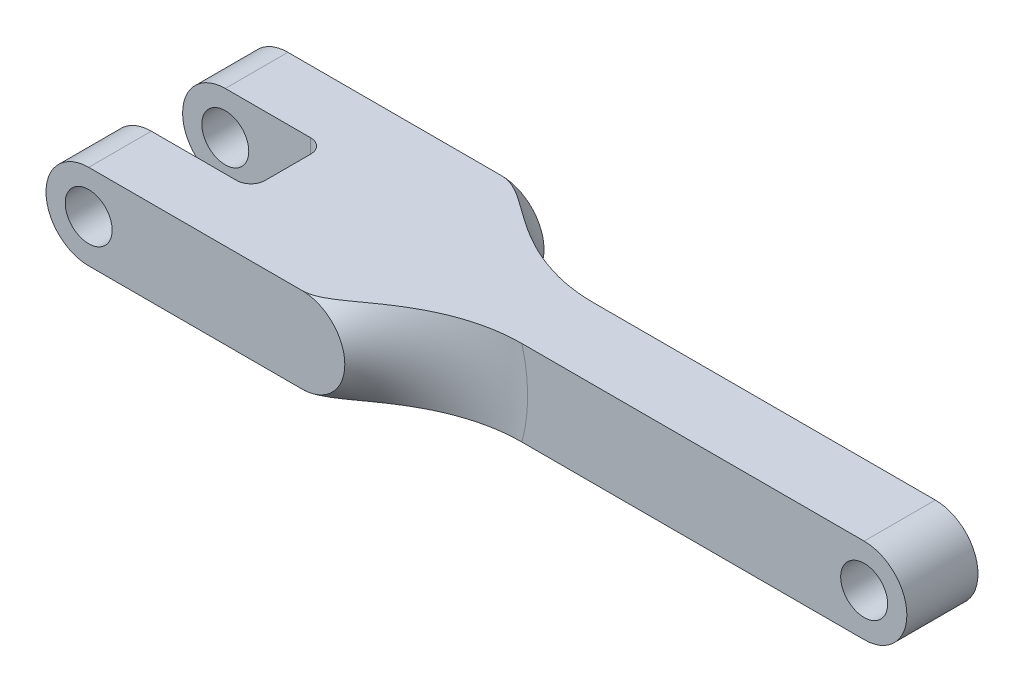
from build123d import *

# Parameters (mm, degrees)
EXTRUDE_1_DEPTH      = 2.5
EXTRUDE_1_DEPTH_BACK = 2.5
SKETCH_1_R           = 1.65
EXTRUDE_2_DEPTH      = 4.5
EXTRUDE_2_DEPTH_BACK = 9.5
SKETCH_2_R           = 1.65
EXTRUDE_3_REACH      = 33.448
SKETCH_4_W           = 20
SKETCH_4_H           = 5.2
CUT_EXTRUDE_1_DEPTH  = 13.5
FILLET_1_R           = 10
FILLET_2_R           = 1


with BuildPart() as part:
    # 草图1 → 凸台-拉伸1 (new, two sides: drawn at the far end of the back side and taken through both)
    with BuildSketch(Plane.XY.offset(-EXTRUDE_1_DEPTH_BACK)):
        with BuildLine():
            Line((-25, 3), (25, 3))
            ThreePointArc((25, 3), (28, 0), (25, -3))
            Line((25, -3), (-25, -3))
            ThreePointArc((-25, -3), (-28, 0), (-25, 3))
        make_face()
        with Locations((-25, 0)):
            Circle(SKETCH_1_R, mode=Mode.SUBTRACT)
        with Locations((25, 0)):
            Circle(SKETCH_1_R, mode=Mode.SUBTRACT)
    extrude(amount=EXTRUDE_1_DEPTH + EXTRUDE_1_DEPTH_BACK)

    # 草图2 → 凸台-拉伸2 (add, two sides: drawn at the far end of the back side and taken through both)
    with BuildSketch(Plane.XY.offset(2.5).offset(-EXTRUDE_2_DEPTH_BACK)):
        with BuildLine():
            ThreePointArc((-25, -3), (-22.878679656, -2.121320344), (-22, 0))
            ThreePointArc((-22, 0), (-22.878679656, 2.121320344), (-25, 3))
            ThreePointArc((-25, 3), (-28, 0), (-25, -3))
        make_face()
        with Locations((-25, 0)):
            Circle(SKETCH_2_R, mode=Mode.SUBTRACT)
    extrude(amount=EXTRUDE_2_DEPTH + EXTRUDE_2_DEPTH_BACK)

    # 凸台-拉伸3: up to this face of the body (flat: up to its plane)
    extrude_3_end = Plane(part.part.faces().sort_by_distance((-25, 2.915147186, -7))[0])
    # 草图3 → 凸台-拉伸3 (add, up to the picked face)
    with BuildSketch(Plane.XY.offset(7), mode=Mode.PRIVATE) as extrude_3_sk1:
        with BuildLine():
            Line((-25, -3), (-10, -3))
            ThreePointArc((-10, -3), (-7, 0), (-10, 3))
            Line((-10, 3), (-25, 3))
            ThreePointArc((-25, 3), (-22, 0), (-25, -3))
        make_face()
    extrude_3_tool1 = split(extrude(extrude_3_sk1.sketch, amount=-EXTRUDE_3_REACH, mode=Mode.PRIVATE), bisect_by=extrude_3_end, keep=Keep.BOTH, mode=Mode.PRIVATE)
    add(extrude_3_tool1.solids().sort_by(Axis((-15.143806, 0, 7), (0, 0, -1)))[0])

    # 草图4 → 切除-拉伸1 (cut)
    with BuildSketch(Plane(origin=(0, 3, 0), x_dir=(1, 0, 0), z_dir=(0, 1, 0))):
        with Locations((-28, 0)):
            Rectangle(SKETCH_4_W, SKETCH_4_H)
    extrude(amount=-CUT_EXTRUDE_1_DEPTH, mode=Mode.SUBTRACT)

    # 圆角1
    # the kernel refuses this fillet: 10 mm, written as the material it adds along each edge
    with BuildSketch(Plane(origin=(-10, 0, -2.5), x_dir=(-0.9999950652018582, -0.0031415874858792066, 0), z_dir=(-0.0031415874858792066, 0.9999950652018582, 0))) as fillet_1_piece_1_section:
        with BuildLine():
            CenterArc((11.351646544, -10), FILLET_1_R, 90, 56.632987031)
            Line((11.351646544, 0), (3, 0))
            Line((3, 0), (3, -4.5))
        make_face()
    fillet_1_piece_1 = revolve(axis=Axis((-10, 0, -2.5), (0, 0, 1)), revolution_arc=359.64, mode=Mode.PRIVATE)
    fillet_1_piece_1 = split(fillet_1_piece_1, bisect_by=Plane(origin=(-4.0130996, 3, -4.037145942), z_dir=(0, -1, 0)), keep=Keep.TOP, mode=Mode.PRIVATE)
    fillet_1_piece_1 = split(fillet_1_piece_1, bisect_by=Plane(origin=(-18, 1e-09, -4.037145942), z_dir=(1, 0, 0)), keep=Keep.TOP, mode=Mode.PRIVATE)
    fillet_1_piece_1 = split(fillet_1_piece_1, bisect_by=Plane(origin=(-4.0130996, -3, -4.037145942), z_dir=(0, 1, 0)), keep=Keep.TOP, mode=Mode.PRIVATE)
    add(fillet_1_piece_1)
    with BuildSketch(Plane(origin=(-10, 0, 2.5), x_dir=(-0.9999950652018582, -0.0031415874858792066, 0), z_dir=(-0.0031415874858792066, 0.9999950652018582, 0))) as fillet_1_piece_2_section:
        with BuildLine():
            CenterArc((11.351646544, 10), FILLET_1_R, 213.367012969, 56.632987031)
            Line((3, 4.5), (3, 0))
            Line((3, 0), (11.351646544, 0))
        make_face()
    fillet_1_piece_2 = revolve(axis=Axis((-10, 0, 2.5), (0, 0, 1)), revolution_arc=359.64, mode=Mode.PRIVATE)
    fillet_1_piece_2 = split(fillet_1_piece_2, bisect_by=Plane(origin=(0.64312555, 3, 2.505081391), z_dir=(0, -1, 0)), keep=Keep.TOP, mode=Mode.PRIVATE)
    fillet_1_piece_2 = split(fillet_1_piece_2, bisect_by=Plane(origin=(-18, 0, 2.505081391), z_dir=(1, 0, 0)), keep=Keep.TOP, mode=Mode.PRIVATE)
    fillet_1_piece_2 = split(fillet_1_piece_2, bisect_by=Plane(origin=(0.64312555, -3, 2.505081391), z_dir=(0, 1, 0)), keep=Keep.TOP, mode=Mode.PRIVATE)
    add(fillet_1_piece_2)

    # 圆角2
    fillet_2_edges = [part.edges().sort_by_distance(p)[0] for p in [
        (-18, 0, 2.6),
        (-18, 0, -2.6),
    ]]
    fillet(fillet_2_edges, radius=FILLET_2_R)


solid = part.part
